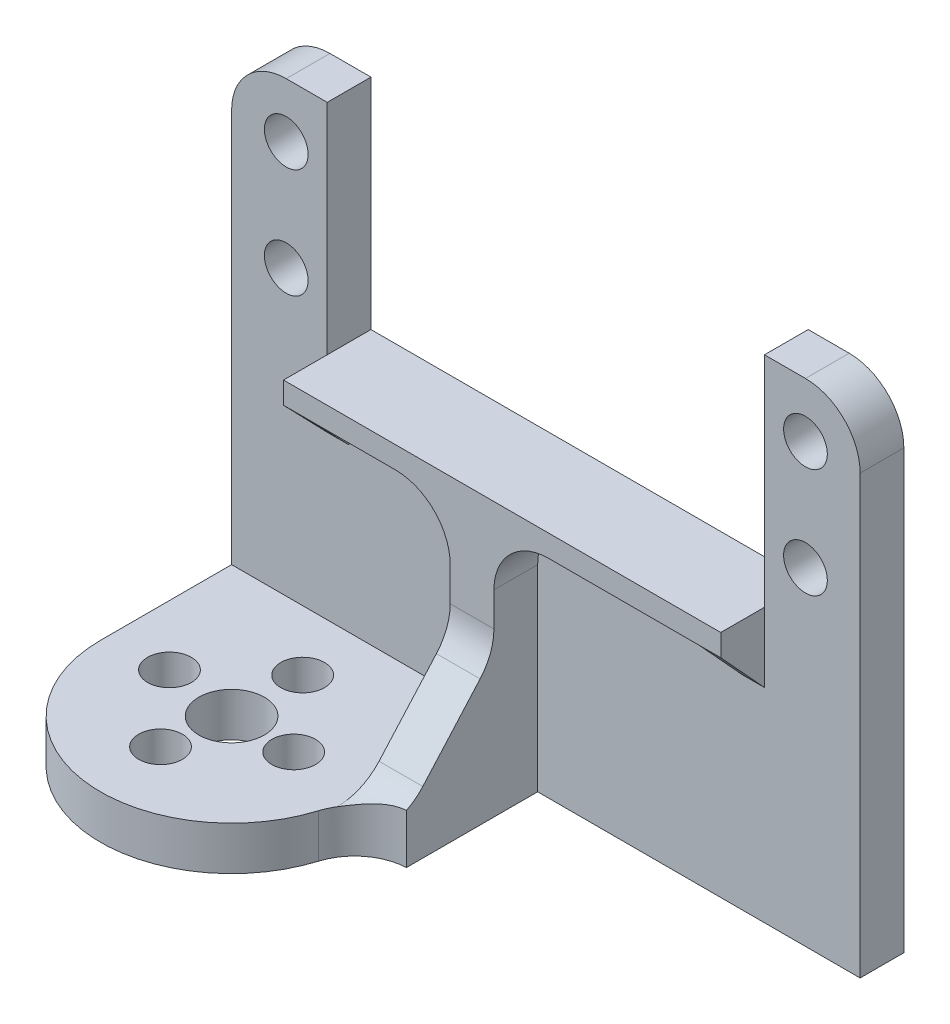
from build123d import *

# Parameters (mm, degrees)
SKETCH1_W           = 57.5
SKETCH1_H           = 45
BOSS_EXTRUDE1_DEPTH = 4
SKETCH4_W           = 24
SKETCH4_H           = 4
BOSS_EXTRUDE4_DEPTH = 24
CUT_EXTRUDE1_START  = -4
CUT_EXTRUDE1_DEPTH  = 4
SKETCH6_R           = 3
SKETCH6_R_2         = 2
CUT_EXTRUDE2_DEPTH  = 24
SKETCH7_R           = 2
SKETCH7_W           = 40
SKETCH7_H           = 20
CUT_EXTRUDE3_DEPTH  = 24
FILLET2_R           = 5
SKETCH9_W           = 40
SKETCH9_H           = 2
BOSS_EXTRUDE5_DEPTH = 4
RIB1_REACH          = 61.005
SKETCH10_WALL_W     = 125.416867366
SKETCH10_WALL_H     = 2
RIB5_REACH          = 61.005
SKETCH11_WALL_W     = 125.5713139
SKETCH11_WALL_H     = 2
SKETCH13_W          = 12
SKETCH13_H          = 4
BOSS_EXTRUDE7_DEPTH = 4
SKETCH15_W          = 4
SKETCH15_H          = 12
BOSS_EXTRUDE8_DEPTH = 19
CUT_EXTRUDE4_DEPTH  = 15
FILLET5_R           = 5
FILLET6_R           = 5


# Read off the part's stored shape, not the designer's step: Cut-Extrude1
with BuildPart() as part:
    # Sketch1 → Boss-Extrude1 (new body)
    with BuildSketch(Plane.XY):
        with Locations((17.830298358, 6.093256958)):
            Rectangle(SKETCH1_W, SKETCH1_H)
    extrude(amount=BOSS_EXTRUDE1_DEPTH)

    # Sketch4 → Boss-Extrude4 (add)
    with BuildSketch(Plane.XY.offset(4)):
        with Locations((1.080298358, -14.406743042)):
            Rectangle(SKETCH4_W, SKETCH4_H)
    extrude(amount=BOSS_EXTRUDE4_DEPTH)

    # Cut-Extrude1 outline → Cut-Extrude1 (cut)
    with BuildSketch(Plane(origin=(0, -12.406743042, 0), x_dir=(1, 0, 0), z_dir=(0, 1, 0)).offset(CUT_EXTRUDE1_START)):
        with BuildLine():
            Line((13.080298358, -28), (13.080298358, -16))
            ThreePointArc((13.080298358, -16), (9.565579732, -24.485281374), (1.080298358, -28))
            Line((1.080298358, -28), (13.080298358, -28))
        make_face()
        with BuildLine():
            Line((-10.919701642, -28), (1.080298358, -28))
            ThreePointArc((1.080298358, -28), (-7.404983016, -24.485281374), (-10.919701642, -16))
            Line((-10.919701642, -16), (-10.919701642, -28))
        make_face()
    extrude(amount=CUT_EXTRUDE1_DEPTH, mode=Mode.SUBTRACT)

    # Sketch6 → Cut-Extrude2 (cut)
    with BuildSketch(Plane(origin=(0, -12.406743042, 0), x_dir=(1, 0, 0), z_dir=(0, 1, 0))):
        with Locations(Location((1.080298358, -16, 0), (0, 0, 270))):
            Circle(SKETCH6_R)
        with Locations(Location((1.080298358, -9.5, 0), (0, 0, 270))):
            Circle(SKETCH6_R_2)
        with Locations(Location((6.762193148, -16, 0), (0, 0, 270))):
            Circle(SKETCH6_R_2)
        with Locations(Location((0.262193148, -21.681894789, 0), (0, 0, 270))):
            Circle(SKETCH6_R_2)
        with Locations(Location((-5.419701642, -15.181894789, 0), (0, 0, 270))):
            Circle(SKETCH6_R_2)
    extrude(amount=-CUT_EXTRUDE2_DEPTH, mode=Mode.SUBTRACT)

    # Sketch7 → Cut-Extrude3 (cut)
    with BuildSketch(Plane.XY.offset(4)):
        with Locations((-5.919701642, 23.593256958)):
            Circle(SKETCH7_R)
        with Locations((-5.919701642, 13.593256958)):
            Circle(SKETCH7_R)
        with Locations((41.580298358, 23.593256958)):
            Circle(SKETCH7_R)
        with Locations((41.580298358, 13.593256958)):
            Circle(SKETCH7_R)
        with Locations((17.830298358, 18.593256958)):
            Rectangle(SKETCH7_W, SKETCH7_H)
    extrude(amount=-CUT_EXTRUDE3_DEPTH, mode=Mode.SUBTRACT)

    # Fillet2
    fillet2_edges = [part.edges().sort_by_distance(p)[0] for p in [
        (-10.919701642, 28.593256958, 2),
        (46.580298358, 28.593256958, 2),
    ]]
    fillet(fillet2_edges, radius=FILLET2_R)

    # Sketch9 → Boss-Extrude5 (add)
    with BuildSketch(Plane.XY.offset(4)):
        with Locations((17.830298358, 7.593256958)):
            Rectangle(SKETCH9_W, SKETCH9_H)
    extrude(amount=BOSS_EXTRUDE5_DEPTH)

    # Sketch10 wall → Rib1 (add, up to next)
    with BuildSketch(Plane(origin=(37.830298358, 4.600713915, 6.172546288), x_dir=(0, -0.736977999751, -0.675916731471), z_dir=(0, 0.675916731471, -0.736977999751)), mode=Mode.PRIVATE) as rib1_sk1:
        with Locations((0, 1)):
            Rectangle(SKETCH10_WALL_W, SKETCH10_WALL_H)
    rib1_tool1 = extrude(rib1_sk1.sketch, amount=RIB1_REACH, mode=Mode.PRIVATE) - part.part
    add(rib1_tool1.solids().sort_by_distance((37.830298358, 4.600713915, 6.172546288))[0])

    # Sketch11 wall → Rib5 (add, up to next)
    with BuildSketch(Plane(origin=(-2.169701642, 4.593256958, 6.067812051), x_dir=(0, -0.719194164668, -0.694809148981), z_dir=(0, 0.694809148981, -0.719194164668)), mode=Mode.PRIVATE) as rib5_sk1:
        with Locations((0, -1)):
            Rectangle(SKETCH11_WALL_W, SKETCH11_WALL_H)
    rib5_tool1 = extrude(rib5_sk1.sketch, amount=RIB5_REACH, mode=Mode.PRIVATE) - part.part
    add(rib5_tool1.solids().sort_by_distance((-2.169701642, 4.593256958, 6.067812051))[0])

    # Sketch13 → Boss-Extrude7 (add)
    with BuildSketch(Plane(origin=(13.080298358, 0, 0), x_dir=(0, 0, -1), z_dir=(1, 0, 0))):
        with Locations((-10, -14.406743042)):
            Rectangle(SKETCH13_W, SKETCH13_H)
    extrude(amount=BOSS_EXTRUDE7_DEPTH)

    # Sketch15 → Boss-Extrude8 (add)
    with BuildSketch(Plane(origin=(0, -12.406743042, 0), x_dir=(1, 0, 0), z_dir=(0, 1, 0))):
        with Locations((15.080298358, -10)):
            Rectangle(SKETCH15_W, SKETCH15_H)
    extrude(amount=BOSS_EXTRUDE8_DEPTH)

    # Sketch16 → Cut-Extrude4 (cut)
    with BuildSketch(Plane.ZY.offset(-13.080298358)):
        Polygon((8, 6.593256958), (8, -3.406743042), (16, -12.406743042), (16, 6.593256958), align=None)
    extrude(amount=-CUT_EXTRUDE4_DEPTH, mode=Mode.SUBTRACT)

    # Fillet5
    # the kernel refuses this fillet: 5 mm, written as the material it adds along each edge
    with BuildSketch(Plane(origin=(13.080298358, -16.406743042, 16), x_dir=(1, 0, 0), z_dir=(0, 1, 0))) as fillet5_piece_1:
        with BuildLine():
            CenterArc((4.25, -4.993746089), FILLET5_R, 92.865983979, 70.051432775)
            ThreePointArc((-0.529411765, -3.524997239), (-0.133090992, -1.782265577), (0, 0))
            Line((0, 0), (4, 0))
        make_face()
    extrude(amount=4)

    # Fillet6
    fillet6_edges = [part.edges().sort_by_distance(p)[0] for p in [
        (17.080298358, 6.593256958, 6),
        (13.080298358, 6.593256958, 6),
        (15.080298358, -3.406743042, 8),
        (15.080298358, -12.406743042, 16),
    ]]
    fillet(fillet6_edges, radius=FILLET6_R)


solid = part.part
